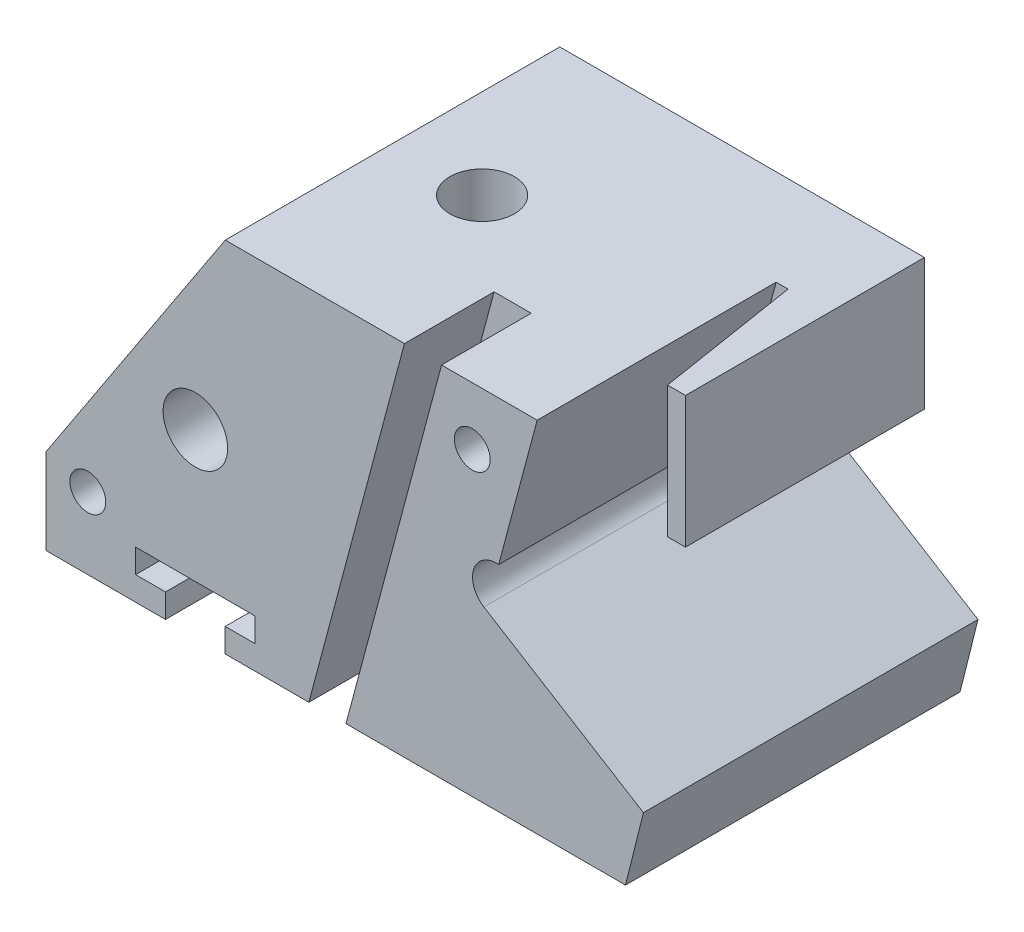
from build123d import *

# Parameters (mm, degrees)
RESSALTO_EXTRUS_O1_DEPTH                   = 56
CORTE_EXTRUS_O1_DEPTH                      = 15
RESSALTO_EXTRUS_O2_DEPTH                   = 56
RESSALTO_EXTRUS_O3_DEPTH                   = 56
CORTE_EXTRUS_O2_REACH                      = 147.702
CORTE_EXTRUS_O4_DEPTH                      = 40
BROCA_DE_ROSQUEAR_PARA_TARRAXA_DE_M12X1_D  = 10.8
BROCA_DE_ROSQUEAR_PARA_TARRAXA_DE_M7X1_0_D = 6
BROCA_DE_ROSQUEAR_PARA_TARRAXA_DE_M7_2_D   = 6
BROCA_DE_ROSQUEAR_PARA_TARRAXA_DE_M1_2_D   = 10.8


with BuildPart() as part:
    # Esboço1 → Ressalto-extrusão1 (new body)
    with BuildSketch(Plane.XY):
        with BuildLine():
            Line((-90.387017339, 80.684076089), (-120.387017339, 35.003724587))
            Line((-120.387017339, 35.003724587), (-120.387017339, 20.684076089))
            Line((-120.387017339, 20.684076089), (-100.387017339, 20.684076089))
            Line((-100.387017339, 20.684076089), (-100.387017339, 24.684076089))
            Line((-100.387017339, 24.684076089), (-105.387017339, 24.684076089))
            Line((-105.387017339, 24.684076089), (-105.387017339, 28.684076089))
            Line((-105.387017339, 28.684076089), (-85.387017339, 28.684076089))
            Line((-85.387017339, 28.684076089), (-85.387017339, 24.684076089))
            Line((-85.387017339, 24.684076089), (-90.387017339, 24.684076089))
            Line((-90.387017339, 24.684076089), (-90.387017339, 20.684076089))
            Line((-90.387017339, 20.684076089), (-23.387017339, 20.684076089))
            Line((-23.387017339, 20.684076089), (-20.387017339, 32.684076089))
            Line((-20.387017339, 32.684076089), (-47.094526464, 49.140604101))
            ThreePointArc((-47.094526464, 49.140604101), (-48.788896043, 53.816986815), (-44.618913725, 56.528202599))
            Line((-44.618913725, 56.528202599), (-38.177347461, 80.684076089))
            Line((-38.177347461, 80.684076089), (-90.387017339, 80.684076089))
        make_face()
    extrude(amount=-RESSALTO_EXTRUS_O1_DEPTH)

    # Esboço1<4> → Corte-extrusão1 (cut)
    with BuildSketch(Plane.XY):
        Polygon((-54.177347461, 80.684076089), (-60.387017339, 80.684076089), (-76.387017339, 20.684076089), (-70.177347461, 20.684076089), align=None)
    extrude(amount=-CORTE_EXTRUS_O1_DEPTH, mode=Mode.SUBTRACT)



with BuildPart() as body_2:
    # Esboço1<5> → Ressalto-extrusão2 (new body)
    with BuildSketch(Plane.XY):
        Polygon((-29.35097492, 80.684076089), (-36.177347461, 80.684076089), (-36.184914088, 58.684076089), (-29.35097492, 58.684076089), align=None)
    extrude(amount=-RESSALTO_EXTRUS_O2_DEPTH)


with BuildPart() as part_1:
    add(part.part)

    add(body_2.part)  # Ressalto-extrusão3 merges body 2
    # Esboço1<7> → Ressalto-extrusão3 (add)
    with BuildSketch(Plane.XY):
        Polygon((-36.177347461, 80.684076089), (-38.177347461, 80.684076089), (-44.044014128, 58.684076089), (-36.184914088, 58.684076089), align=None)
    extrude(amount=-RESSALTO_EXTRUS_O3_DEPTH)

    # Esboço3 → Corte-extrusão2 (cut, up to next)
    with BuildSketch(Plane(origin=(0, 80.684076089, 0), x_dir=(1, 0, 0), z_dir=(0, 1, 0)), mode=Mode.PRIVATE) as corte_extrus_o2_sk1:
        Polygon((-29.35097492, 16), (-32.35097492, 16), (-36.177347461, 40), (-38.177347461, 40), (-38.177347461, 0), (-29.35097492, 0), align=None)
    corte_extrus_o2_tool1 = extrude(corte_extrus_o2_sk1.sketch, amount=-CORTE_EXTRUS_O2_REACH, mode=Mode.PRIVATE) & part_1.part
    add(corte_extrus_o2_tool1.solids().sort_by_distance((-34.683081, 80.684076, -15.207089))[0], mode=Mode.SUBTRACT)

    # Esboço1<8> → Corte-extrusão4 (cut)
    with BuildSketch(Plane.XY):
        Polygon((-36.177347461, 80.684076089), (-38.177347461, 80.684076089), (-44.044014128, 58.684076089), (-36.184914088, 58.684076089), align=None)
    extrude(amount=-CORTE_EXTRUS_O4_DEPTH, mode=Mode.SUBTRACT)

    # Broca de rosquear para tarraxa de M12x1 (through all)
    with Locations(Plane.XY):
        with Locations((-95.387017339, 50.684076089)):
            Hole(BROCA_DE_ROSQUEAR_PARA_TARRAXA_DE_M12X1_D / 2)

    # Broca de rosquear para tarraxa de M7x1.0 (through all)
    with Locations(Plane.XY):
        with Locations((-113.387017339, 32.684076089)):
            Hole(BROCA_DE_ROSQUEAR_PARA_TARRAXA_DE_M7X1_0_D / 2)

    # Broca de rosquear para tarraxa de M7 2 (through all)
    with Locations(Plane.XY):
        with Locations((-49.033533805, 71.021726693)):
            Hole(BROCA_DE_ROSQUEAR_PARA_TARRAXA_DE_M7_2_D / 2)

    # Broca de rosquear para tarraxa de M1 2 (through all)
    with Locations(Plane(origin=(0, 80.684076089, 0), x_dir=(1, 0, 0), z_dir=(0, 1, 0))):
        with Locations((-75.387017339, 28)):
            Hole(BROCA_DE_ROSQUEAR_PARA_TARRAXA_DE_M1_2_D / 2)


solid = part_1.part
